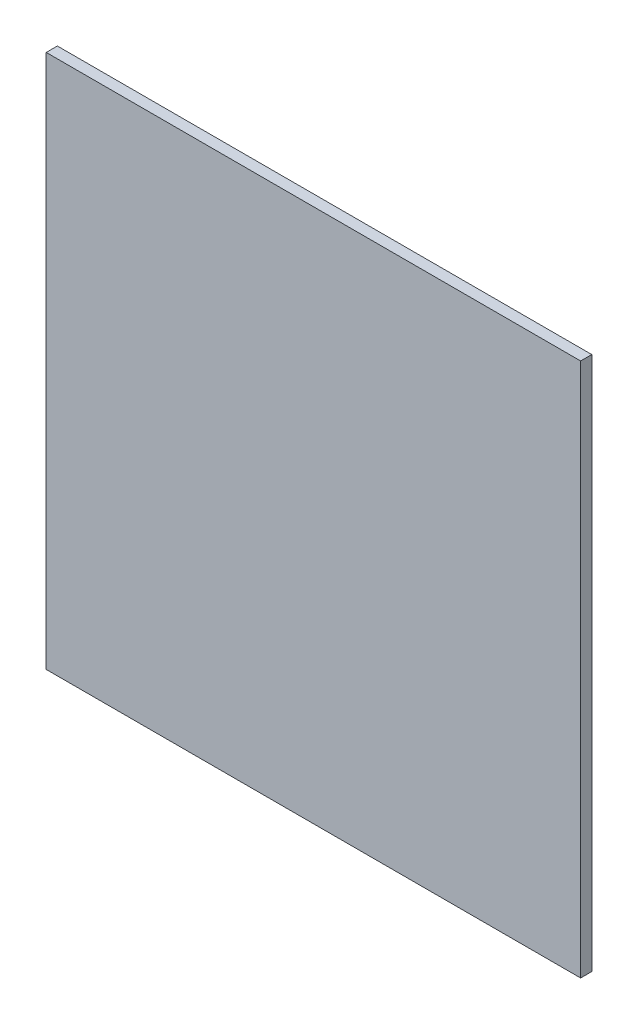
from build123d import *

# Parameters (mm, degrees)
SKETCH2_W           = 304.8
SKETCH2_H           = 304.8
BOSS_EXTRUDE1_DEPTH = 6.35


with BuildPart() as part:
    # Sketch2 → Boss-Extrude1 (new body)
    with BuildSketch(Plane.XY):
        Rectangle(SKETCH2_W, SKETCH2_H)
    extrude(amount=BOSS_EXTRUDE1_DEPTH)


solid = part.part
